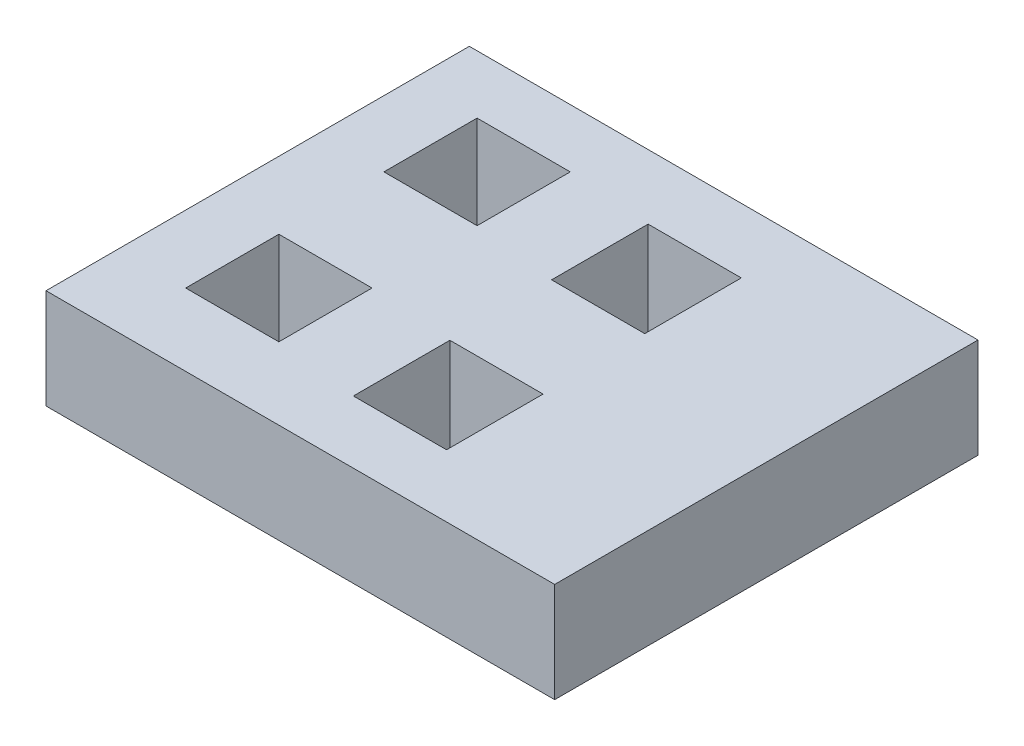
from build123d import *

# Parameters (mm, degrees)
SKETCH1_W           = 15.283653132
SKETCH1_H           = 12.7192818
SKETCH1_W_2         = 2.8
SKETCH1_H_2         = 2.8
SKETCH1_H_3         = 2.9
BOSS_EXTRUDE1_DEPTH = 3


with BuildPart() as part:
    # Sketch1 → Boss-Extrude1 (new body)
    with BuildSketch(Plane(origin=(0, 0, 0), x_dir=(1, 0, 0), z_dir=(0, 1, 0))):
        with Locations((1.695912807, 0.520164281)):
            Rectangle(SKETCH1_W, SKETCH1_H)
        with Locations((-2.517491906, -2.271207386)):
            Rectangle(SKETCH1_W_2, SKETCH1_H_2, mode=Mode.SUBTRACT)
        with Locations((-2.561940628, 3.728792614)):
            Rectangle(SKETCH1_W_2, SKETCH1_H_2, mode=Mode.SUBTRACT)
        with Locations((2.811081296, -2.510983936)):
            Rectangle(SKETCH1_W_2, SKETCH1_H_3, mode=Mode.SUBTRACT)
        with Locations((2.766632574, 3.489016064)):
            Rectangle(SKETCH1_W_2, SKETCH1_H_3, mode=Mode.SUBTRACT)
    extrude(amount=BOSS_EXTRUDE1_DEPTH)


solid = part.part
